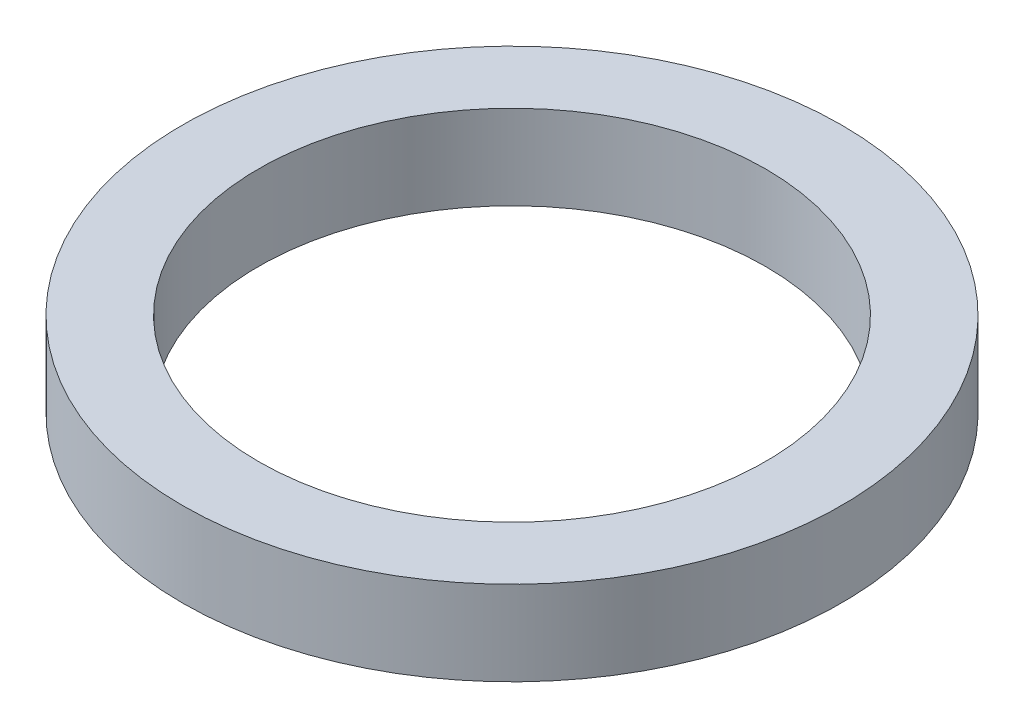
from build123d import *

# Parameters (mm, degrees)
SKETCH1_R           = 39
SKETCH1_R_2         = 30
BOSS_EXTRUDE1_DEPTH = 5


with BuildPart() as part:
    # Sketch1 → Boss-Extrude1 (new, symmetric)
    with BuildSketch(Plane(origin=(0, 0, 0), x_dir=(1, 0, 0), z_dir=(0, 1, 0))):
        Circle(SKETCH1_R)
        Circle(SKETCH1_R_2, mode=Mode.SUBTRACT)
    extrude(amount=BOSS_EXTRUDE1_DEPTH, both=True)


solid = part.part
